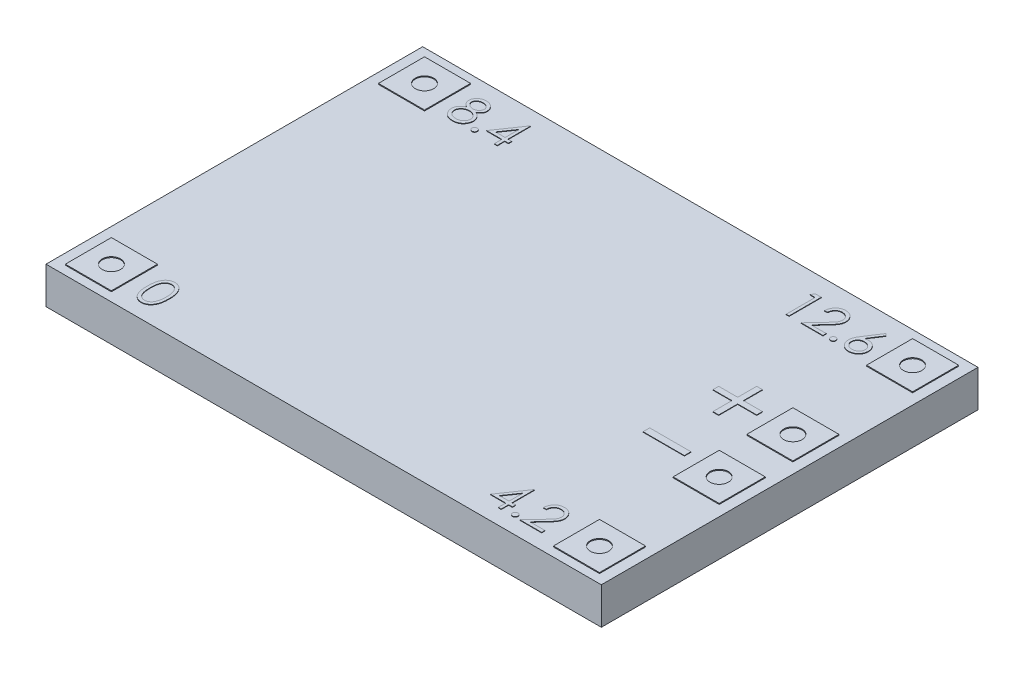
from build123d import *

# Parameters (mm, degrees)
SKETCH_1_W         = 60.3
SKETCH_1_H         = 40.9
EXTRUDE_1_DEPTH    = 4
SKETCH_2_W         = 5
SKETCH_2_H         = 5
SKETCH_2_R         = 1
EXTRUDE_2_DEPTH    = 0.1
EXTRUDE_2_2_DEPTH  = 0.1
EXTRUDE_2_3_DEPTH  = 0.1
EXTRUDE_2_4_DEPTH  = 0.1
EXTRUDE_2_5_DEPTH  = 0.1
EXTRUDE_2_6_DEPTH  = 0.1
EXTRUDE_3_DEPTH    = 0.05
SKETCH_3_W         = 4.487179487
SKETCH_3_H         = 0.717948718
EXTRUDE_3_2_DEPTH  = 0.05
EXTRUDE_3_3_DEPTH  = 0.05
EXTRUDE_3_4_DEPTH  = 0.05
EXTRUDE_3_5_DEPTH  = 0.05
EXTRUDE_3_6_DEPTH  = 0.05
EXTRUDE_3_7_DEPTH  = 0.05
EXTRUDE_3_8_DEPTH  = 0.05
EXTRUDE_3_9_DEPTH  = 0.05
EXTRUDE_3_10_DEPTH = 0.05
EXTRUDE_3_11_DEPTH = 0.05
EXTRUDE_3_12_DEPTH = 0.05
EXTRUDE_3_13_DEPTH = 0.05


with BuildPart() as part:
    # Эскиз1 → Бобышка-Вытянуть1 (new body)
    with BuildSketch(Plane(origin=(0, 0, 0), x_dir=(1, 0, 0), z_dir=(0, 1, 0))):
        Rectangle(SKETCH_1_W, SKETCH_1_H)
    extrude(amount=EXTRUDE_1_DEPTH)


with BuildPart() as body_2:
    # Эскиз2 → Бобышка-Вытянуть2 (new body)
    with BuildSketch(Plane(origin=(0, 4, 0), x_dir=(1, 0, 0), z_dir=(0, 1, 0))):
        with Locations((-26.5, -17)):
            Rectangle(SKETCH_2_W, SKETCH_2_H)
        with Locations((-26.5, -17)):
            Circle(SKETCH_2_R, mode=Mode.SUBTRACT)
    extrude(amount=EXTRUDE_2_DEPTH)


with BuildPart() as body_3:
    # Эскиз2 → Extrude 2 2 (new body)
    with BuildSketch(Plane(origin=(0, 4, 0), x_dir=(1, 0, 0), z_dir=(0, 1, 0))):
        with Locations((-26.5, 17)):
            Rectangle(SKETCH_2_W, SKETCH_2_H)
        with Locations((-26.5, 17)):
            Circle(SKETCH_2_R, mode=Mode.SUBTRACT)
    extrude(amount=EXTRUDE_2_2_DEPTH)


with BuildPart() as body_4:
    # Эскиз2 → Extrude 2 3 (new body)
    with BuildSketch(Plane(origin=(0, 4, 0), x_dir=(1, 0, 0), z_dir=(0, 1, 0))):
        with Locations((26.5, 17)):
            Rectangle(SKETCH_2_W, SKETCH_2_H)
        with Locations((26.5, 17)):
            Circle(SKETCH_2_R, mode=Mode.SUBTRACT)
    extrude(amount=EXTRUDE_2_3_DEPTH)


with BuildPart() as body_5:
    # Эскиз2 → Extrude 2 4 (new body)
    with BuildSketch(Plane(origin=(0, 4, 0), x_dir=(1, 0, 0), z_dir=(0, 1, 0))):
        with Locations((26.5, -17)):
            Rectangle(SKETCH_2_W, SKETCH_2_H)
        with Locations((26.5, -17)):
            Circle(SKETCH_2_R, mode=Mode.SUBTRACT)
    extrude(amount=EXTRUDE_2_4_DEPTH)


with BuildPart() as body_6:
    # Эскиз2 → Extrude 2 5 (new body)
    with BuildSketch(Plane(origin=(0, 4, 0), x_dir=(1, 0, 0), z_dir=(0, 1, 0))):
        with Locations((26.5, 4)):
            Rectangle(SKETCH_2_W, SKETCH_2_H)
        with Locations((26.5, 4)):
            Circle(SKETCH_2_R, mode=Mode.SUBTRACT)
    extrude(amount=EXTRUDE_2_5_DEPTH)


with BuildPart() as body_7:
    # Эскиз2 → Extrude 2 6 (new body)
    with BuildSketch(Plane(origin=(0, 4, 0), x_dir=(1, 0, 0), z_dir=(0, 1, 0))):
        with Locations((26.5, -4)):
            Rectangle(SKETCH_2_W, SKETCH_2_H)
        with Locations((26.5, -4)):
            Circle(SKETCH_2_R, mode=Mode.SUBTRACT)
    extrude(amount=EXTRUDE_2_6_DEPTH)


with BuildPart() as body_8:
    # Эскиз3 → Бобышка-Вытянуть3 (new body)
    with BuildSketch(Plane(origin=(0, 4, 0), x_dir=(1, 0, 0), z_dir=(0, 1, 0))):
        Polygon((19.969849087, 4.535068016), (19.969849087, 6.59917058), (20.598054215, 6.59917058), (20.598054215, 4.535068016), (22.662156779, 4.535068016), (22.662156779, 3.906862888), (20.598054215, 3.906862888), (20.598054215, 1.842760324), (19.969849087, 1.842760324), (19.969849087, 3.906862888), (17.905746523, 3.906862888), (17.905746523, 4.535068016), align=None)
    extrude(amount=EXTRUDE_3_DEPTH)


with BuildPart() as body_9:
    # Эскиз3 → Extrude 3 2 (new body)
    with BuildSketch(Plane(origin=(0, 4, 0), x_dir=(1, 0, 0), z_dir=(0, 1, 0))):
        with Locations((20.312976952, -3.479588137)):
            Rectangle(SKETCH_3_W, SKETCH_3_H)
    extrude(amount=EXTRUDE_3_2_DEPTH)


with BuildPart() as body_10:
    # Эскиз3 → Extrude 3 3 (new body)
    with BuildSketch(Plane(origin=(0, 4, 0), x_dir=(1, 0, 0), z_dir=(0, 1, 0))):
        Polygon((14.459435764, 18.478011487), (15.106571181, 18.478011487), (15.106571181, 14.978011487), (14.792468617, 14.978011487), (14.792468617, 18.119037128), (14.254007078, 18.119037128), align=None)
    extrude(amount=EXTRUDE_3_3_DEPTH)


with BuildPart() as body_11:
    # Эскиз3 → Extrude 3 4 (new body)
    with BuildSketch(Plane(origin=(0, 4, 0), x_dir=(1, 0, 0), z_dir=(0, 1, 0))):
        with BuildLine():
            Line((16.856571181, 17.40108841), (16.542468617, 17.40108841))
            add(Edge.make_bspline(
                [(16.542468617, 17.40108841), (16.54451577, 17.442759298), (16.548536324, 17.524599812), (16.567364613, 17.643923719), (16.59430549, 17.757978517), (16.632396944, 17.865848431), (16.679703222, 17.968487239), (16.736433249, 18.065487254), (16.8036271, 18.156478443), (16.879833834, 18.240617286), (16.962602473, 18.317804857), (17.051908412, 18.3844601), (17.14575344, 18.440777771), (17.243852839, 18.487859013), (17.347313402, 18.523198859), (17.45519626, 18.549420499), (17.567975396, 18.565196844), (17.644815418, 18.56689263), (17.683894899, 18.567755077)],
                knots=[0, 0, 0, 0, 1.10065271, 2.161652631, 3.183658789, 4.190468796, 5.17591951, 6.163126047, 7.15150782, 8.156236427, 9.156009102, 10.134482811, 11.092018607, 12.041330605, 13.001268258, 13.972401359, 14.968799086, 16, 16, 16, 16], degree=3))
            add(Edge.make_bspline(
                [(17.683894899, 18.567755077), (17.722272973, 18.56685662), (17.797684517, 18.565091185), (17.907746532, 18.549930156), (18.012523826, 18.526184564), (18.111811593, 18.492869148), (18.204817657, 18.448084721), (18.292240702, 18.394287182), (18.375121513, 18.332067351), (18.449728296, 18.258813537), (18.518236376, 18.180611153), (18.577338631, 18.097123249), (18.627951794, 18.010893963), (18.670139474, 17.921265762), (18.701195613, 17.827394733), (18.724773821, 17.730647531), (18.738101235, 17.63002272), (18.740146658, 17.561916164), (18.741186565, 17.527290333)],
                knots=[0, 0, 0, 0, 1.111607364, 2.184268762, 3.212621178, 4.221274766, 5.211760367, 6.196651075, 7.1921475, 8.207485113, 9.220403448, 10.201281604, 11.166441695, 12.114753415, 13.065576456, 14.026450734, 14.996634279, 16, 16, 16, 16], degree=3))
            add(Edge.make_bspline(
                [(18.741186565, 17.527290333), (18.739493302, 17.478542498), (18.736136491, 17.381902285), (18.707422115, 17.239887422), (18.662575603, 17.102294003), (18.608578247, 16.991556701), (18.554105803, 16.902323207), (18.505018295, 16.828854502), (18.447553484, 16.749749034), (18.380874986, 16.665271696), (18.306362114, 16.574760791), (18.22333995, 16.478270996), (18.131216468, 16.376799226), (18.066557968, 16.307493625), (18.033053552, 16.271581198)],
                knots=[0, 0, 0, 0, 1.184426356, 2.348067706, 3.509069118, 4.696110526, 5.333549288, 6.050745305, 6.844228056, 7.710549037, 8.667450064, 9.695053472, 10.805634456, 12, 12, 12, 12], degree=3))
            Line((18.033053552, 16.271581198), (17.157352431, 15.336985846))
            Line((17.157352431, 15.336985846), (18.78605836, 15.336985846))
            Line((18.78605836, 15.336985846), (18.78605836, 14.978011487))
            Line((18.78605836, 14.978011487), (16.407853232, 14.978011487))
            Line((16.407853232, 14.978011487), (17.765225027, 16.426529115))
            add(Edge.make_bspline(
                [(17.765225027, 16.426529115), (17.798272914, 16.461027422), (17.861751141, 16.527291608), (17.951533718, 16.624034568), (18.032172706, 16.713784109), (18.104190099, 16.796370657), (18.166023604, 16.873002225), (18.220895836, 16.941196929), (18.264861427, 17.003951379), (18.312576823, 17.076691993), (18.358790804, 17.16550431), (18.39850316, 17.274037999), (18.422718009, 17.385765252), (18.425622844, 17.461267289), (18.427084001, 17.499245461)],
                knots=[0, 0, 0, 0, 1.329631726, 2.553950428, 3.673215718, 4.687767853, 5.603093632, 6.413772471, 7.123043292, 7.734684054, 8.834405432, 9.900288307, 10.943827018, 12, 12, 12, 12], degree=3))
            add(Edge.make_bspline(
                [(18.427084001, 17.499245461), (18.426448259, 17.52312686), (18.425195333, 17.57019251), (18.414137635, 17.639198269), (18.397427129, 17.705763083), (18.373481871, 17.770091702), (18.341875131, 17.831537354), (18.303401751, 17.890174834), (18.259011688, 17.946863799), (18.207660419, 18.000017097), (18.151248899, 18.048698303), (18.091654649, 18.091822388), (18.028604545, 18.127861499), (17.962364423, 18.157404996), (17.893118953, 18.180580377), (17.820734208, 18.196638957), (17.745410192, 18.206721441), (17.693976696, 18.208085613), (17.667769097, 18.208780718)],
                knots=[0, 0, 0, 0, 0.991446411, 1.95395049, 2.89581595, 3.838931463, 4.798493298, 5.75982156, 6.748411868, 7.785213223, 8.824556874, 9.840280684, 10.836137867, 11.835679398, 12.848801643, 13.863922112, 14.911575587, 16, 16, 16, 16], degree=3))
            add(Edge.make_bspline(
                [(17.667769097, 18.208780718), (17.640398265, 18.208065685), (17.586646468, 18.20666148), (17.507727435, 18.196838816), (17.432441658, 18.179892976), (17.360599755, 18.156716301), (17.292080169, 18.127257752), (17.227216125, 18.090566008), (17.166153236, 18.046782515), (17.108776712, 17.997141958), (17.055912733, 17.941874357), (17.009465858, 17.880264394), (16.968881843, 17.813436979), (16.93347261, 17.741572428), (16.90471692, 17.664018648), (16.882743769, 17.581050943), (16.865356923, 17.493029562), (16.859548402, 17.432244477), (16.856571181, 17.40108841)],
                knots=[0, 0, 0, 0, 1.031018746, 2.02475058, 2.990194455, 3.934040569, 4.864654155, 5.795059489, 6.735614925, 7.690564532, 8.649604399, 9.611025574, 10.590972636, 11.591080095, 12.624614302, 13.701020113, 14.821632451, 16, 16, 16, 16], degree=3))
        make_face()
    extrude(amount=EXTRUDE_3_4_DEPTH)


with BuildPart() as body_12:
    # Эскиз3 → Extrude 3 5 (new body)
    with BuildSketch(Plane(origin=(0, 4, 0), x_dir=(1, 0, 0), z_dir=(0, 1, 0))):
        with BuildLine():
            add(Edge.make_bspline(
                [(19.66105836, 15.516473025), (19.680548572, 15.515314859), (19.718756855, 15.513044408), (19.773995983, 15.497467734), (19.823990643, 15.469809074), (19.868522888, 15.432946296), (19.905229364, 15.388250632), (19.933873716, 15.338654724), (19.949314701, 15.282953131), (19.951568613, 15.244523456), (19.952725027, 15.224806359)],
                knots=[0, 0, 0, 0, 1.020151414, 1.999887582, 2.974338812, 3.990962822, 5.007586832, 5.987933904, 6.967670073, 8, 8, 8, 8], degree=3))
            add(Edge.make_bspline(
                [(19.952725027, 15.224806359), (19.951529426, 15.205563029), (19.949171719, 15.167615465), (19.933909111, 15.112334002), (19.905011061, 15.062707098), (19.868776068, 15.01740496), (19.823979634, 14.980464089), (19.773877788, 14.953040745), (19.71888653, 14.936348765), (19.680570206, 14.934222468), (19.66105836, 14.933139692)],
                knots=[0, 0, 0, 0, 1.009421747, 1.99056486, 2.972319754, 3.999869655, 5.017953583, 5.993804169, 6.978383603, 8, 8, 8, 8], degree=3))
            add(Edge.make_bspline(
                [(19.66105836, 14.933139692), (19.641532455, 14.934183289), (19.603412772, 14.936220664), (19.548626778, 14.95338347), (19.498219809, 14.980206931), (19.453432097, 15.01747384), (19.416893626, 15.062473984), (19.389268243, 15.11267578), (19.372678094, 15.167457217), (19.370496221, 15.20553186), (19.369391693, 15.224806359)],
                knots=[0, 0, 0, 0, 1.022052826, 1.995314843, 2.982371812, 4.00089066, 5.028879526, 6.005146991, 6.990147033, 8, 8, 8, 8], degree=3))
            add(Edge.make_bspline(
                [(19.369391693, 15.224806359), (19.370453793, 15.244555738), (19.372527411, 15.283113978), (19.389303071, 15.338313086), (19.416679283, 15.388481525), (19.453684678, 15.432878105), (19.498208974, 15.470065408), (19.548505179, 15.497130201), (19.60354472, 15.513170613), (19.641554658, 15.51535313), (19.66105836, 15.516473025)],
                knots=[0, 0, 0, 0, 1.032775665, 2.016367738, 2.991239715, 4.008302682, 5.025365648, 6.011011707, 6.979408107, 8, 8, 8, 8], degree=3))
        make_face()
    extrude(amount=EXTRUDE_3_5_DEPTH)


with BuildPart() as body_13:
    # Эскиз3 → Extrude 3 6 (new body)
    with BuildSketch(Plane(origin=(0, 4, 0), x_dir=(1, 0, 0), z_dir=(0, 1, 0))):
        with BuildLine():
            Line((22.016827591, 18.567755077), (22.25871461, 18.37775107))
            Line((22.25871461, 18.37775107), (21.333934963, 16.96358841))
            add(Edge.make_bspline(
                [(21.333934963, 16.96358841), (21.39550524, 16.97340227), (21.515605026, 16.992545315), (21.637170925, 16.995703261), (21.696414931, 16.997242256)],
                knots=[0, 0, 0, 0, 1.025318673, 2, 2, 2, 2], degree=3))
            add(Edge.make_bspline(
                [(21.696414931, 16.997242256), (21.731987427, 16.996286144), (21.802010827, 16.994404067), (21.90481763, 16.979920216), (22.003606566, 16.957095104), (22.097968178, 16.923822848), (22.18824116, 16.881320494), (22.274943556, 16.830381624), (22.356445566, 16.768375943), (22.433796745, 16.699110988), (22.504023843, 16.622394003), (22.566199898, 16.540992666), (22.61842669, 16.454991785), (22.660800611, 16.364434919), (22.69370549, 16.26946166), (22.717693135, 16.17019352), (22.731872728, 16.066562049), (22.733798219, 15.996083874), (22.734776309, 15.960283121)],
                knots=[0, 0, 0, 0, 1.04369286, 2.054478336, 3.041073146, 4.015093852, 4.984733326, 5.965804835, 6.960378782, 7.985147595, 9.009457201, 10.008161701, 10.986880575, 11.956520048, 12.937015923, 13.931873656, 14.949455224, 16, 16, 16, 16], degree=3))
            add(Edge.make_bspline(
                [(22.734776309, 15.960283121), (22.733353204, 15.911303417), (22.73055287, 15.814922951), (22.702649074, 15.674546245), (22.65928943, 15.54081373), (22.597311901, 15.415860558), (22.520329518, 15.299857989), (22.426451926, 15.197072523), (22.319008437, 15.105402486), (22.197521639, 15.028745867), (22.066778675, 14.966142816), (21.929426677, 14.921177574), (21.786799531, 14.893494104), (21.689994923, 14.890023501), (21.641026309, 14.888267897)],
                knots=[0, 0, 0, 0, 1.031375318, 2.029502543, 3.004789286, 3.987476834, 4.960371455, 5.9300674, 6.912260825, 7.929083631, 8.949397511, 9.960523116, 10.96833055, 12, 12, 12, 12], degree=3))
            add(Edge.make_bspline(
                [(21.641026309, 14.888267897), (21.593929608, 14.889796103), (21.50063929, 14.892823211), (21.363406496, 14.919789149), (21.231543479, 14.963496251), (21.105974098, 15.02371053), (20.989653485, 15.099768413), (20.885587848, 15.191330692), (20.794296074, 15.296440157), (20.718321453, 15.415080504), (20.658062721, 15.542570462), (20.612872796, 15.675507618), (20.586476553, 15.8134076), (20.582787996, 15.906888739), (20.580930155, 15.953973025)],
                knots=[0, 0, 0, 0, 1.012016664, 2.004627821, 2.994792927, 3.992885782, 4.990978636, 5.973936114, 6.964471063, 7.975201453, 8.993600317, 9.990122807, 10.98767138, 12, 12, 12, 12], degree=3))
            add(Edge.make_bspline(
                [(20.580930155, 15.953973025), (20.5821116, 15.990017608), (20.584523885, 16.06361376), (20.601367275, 16.175077788), (20.62843207, 16.28912887), (20.658742316, 16.385883064), (20.690767927, 16.465144586), (20.717420466, 16.529048076), (20.750594462, 16.59480915), (20.785967843, 16.664682785), (20.826724712, 16.736868218), (20.871040362, 16.812571888), (20.920140013, 16.890589815), (20.954560175, 16.943534011), (20.972156117, 16.970599628)],
                knots=[0, 0, 0, 0, 1.173818275, 2.396712641, 3.66331629, 4.989737886, 5.693666774, 6.447286557, 7.243889047, 8.091586357, 8.998013824, 9.943181721, 10.948533338, 12, 12, 12, 12], degree=3))
            Line((20.972156117, 16.970599628), (22.016827591, 18.567755077))
        make_face()
        with BuildLine():
            add(Edge.make_bspline(
                [(21.630509482, 16.638267897), (21.603847237, 16.637489853), (21.551768128, 16.635970108), (21.475360713, 16.627144856), (21.403047462, 16.610525791), (21.333870328, 16.589359459), (21.269122625, 16.560256399), (21.208333785, 16.5249046), (21.151268733, 16.483283422), (21.098525182, 16.435982511), (21.050705518, 16.384194478), (21.009524387, 16.328724955), (20.974001987, 16.270910752), (20.945120168, 16.21026881), (20.922630093, 16.146822311), (20.906361842, 16.080863061), (20.897308091, 16.011948755), (20.895801859, 15.965216252), (20.895032719, 15.941352833)],
                knots=[0, 0, 0, 0, 1.129588631, 2.206414736, 3.251139165, 4.268635594, 5.265702196, 6.250456724, 7.242448911, 8.251968645, 9.246821453, 10.222880186, 11.173611482, 12.116736599, 13.062300278, 14.020270554, 14.989073742, 16, 16, 16, 16], degree=3))
            add(Edge.make_bspline(
                [(20.895032719, 15.941352833), (20.895659081, 15.917702853), (20.896887282, 15.871328763), (20.908039602, 15.802989584), (20.925074684, 15.737224675), (20.95041508, 15.674373077), (20.980641968, 15.613476758), (21.020547293, 15.556741473), (21.064764078, 15.500721403), (21.117618012, 15.449719932), (21.174341375, 15.402263307), (21.234942577, 15.360783054), (21.298102537, 15.32529688), (21.364673959, 15.297485783), (21.433712343, 15.274661496), (21.505792897, 15.258600017), (21.580965753, 15.249519491), (21.631887691, 15.248011297), (21.657853232, 15.247242256)],
                knots=[0, 0, 0, 0, 0.989467248, 1.94019797, 2.891935182, 3.827694429, 4.772920941, 5.730924762, 6.725747692, 7.756678648, 8.79901574, 9.819492441, 10.826891316, 11.826466727, 12.835195252, 13.867842842, 14.912794438, 16, 16, 16, 16], degree=3))
            add(Edge.make_bspline(
                [(21.657853232, 15.247242256), (21.68381873, 15.248011357), (21.734740585, 15.249519669), (21.809914045, 15.258599338), (21.881992364, 15.274663986), (21.951038873, 15.297476756), (22.017580304, 15.325330366), (22.080685025, 15.360562286), (22.140713119, 15.402518403), (22.197473718, 15.449638832), (22.250107657, 15.501011684), (22.295384935, 15.556241406), (22.334068169, 15.613935301), (22.365502356, 15.674133191), (22.390563647, 15.737262679), (22.407685114, 15.802979403), (22.418814403, 15.871331429), (22.420045769, 15.917703753), (22.420673745, 15.941352833)],
                knots=[0, 0, 0, 0, 1.087397944, 2.132534446, 3.165364764, 4.174271784, 5.174024072, 6.181601208, 7.194203697, 8.236725232, 9.267838612, 10.269026844, 11.221737037, 12.171628256, 13.107553087, 14.05945871, 15.010357665, 16, 16, 16, 16], degree=3))
            add(Edge.make_bspline(
                [(22.420673745, 15.941352833), (22.420123452, 15.965247384), (22.419043406, 16.012144616), (22.406827457, 16.080832235), (22.389885083, 16.147157441), (22.364302052, 16.21070339), (22.331065508, 16.271219317), (22.290582101, 16.329010918), (22.24374953, 16.384521265), (22.189651991, 16.436084074), (22.130761757, 16.483231152), (22.068146171, 16.524850708), (22.002638198, 16.559975685), (21.934304255, 16.589282787), (21.862361373, 16.610432261), (21.787971033, 16.627085504), (21.710181791, 16.635947522), (21.657405183, 16.637484587), (21.630509482, 16.638267897)],
                knots=[0, 0, 0, 0, 0.978206639, 1.919901502, 2.851605144, 3.780102724, 4.718870031, 5.675451981, 6.667674623, 7.690630536, 8.733308323, 9.756129687, 10.767539656, 11.776269907, 12.797430371, 13.836405707, 14.897401972, 16, 16, 16, 16], degree=3))
        make_face(mode=Mode.SUBTRACT)
    extrude(amount=EXTRUDE_3_6_DEPTH)


with BuildPart() as body_14:
    # Эскиз3 → Extrude 3 7 (new body)
    with BuildSketch(Plane(origin=(0, 4, 0), x_dir=(1, 0, 0), z_dir=(0, 1, 0))):
        with BuildLine():
            add(Edge.make_bspline(
                [(-21.036907543, 17.122772779), (-21.008258996, 17.107834824), (-20.952384762, 17.078700821), (-20.872807554, 17.031789993), (-20.800082552, 16.982349028), (-20.73219199, 16.932713169), (-20.67032864, 16.880981517), (-20.615184227, 16.826948361), (-20.565396607, 16.771962416), (-20.521969823, 16.715092576), (-20.483772986, 16.656489926), (-20.450760851, 16.596000653), (-20.422543648, 16.53375732), (-20.400180709, 16.46908049), (-20.381758918, 16.402920228), (-20.369083313, 16.334422246), (-20.362266395, 16.264037905), (-20.360977581, 16.216469604), (-20.360325011, 16.192384158)],
                knots=[0, 0, 0, 0, 1.272397273, 2.481599622, 3.635517121, 4.734568067, 5.792894095, 6.808321871, 7.773003508, 8.711915296, 9.623354172, 10.525449501, 11.423591555, 12.311487226, 13.218079475, 14.126165749, 15.051214107, 16, 16, 16, 16], degree=3))
            add(Edge.make_bspline(
                [(-20.360325011, 16.192384158), (-20.361096432, 16.158686425), (-20.362623363, 16.091985968), (-20.375923347, 15.993539857), (-20.395836325, 15.897928075), (-20.424915837, 15.805171584), (-20.462629228, 15.715782211), (-20.509106064, 15.629683437), (-20.561717269, 15.545464128), (-20.603969509, 15.493644726), (-20.62534905, 15.467424222)],
                knots=[0, 0, 0, 0, 1.025265484, 2.029385089, 3.018602448, 3.995076438, 4.983346944, 5.966715145, 6.97116228, 8, 8, 8, 8], degree=3))
            add(Edge.make_bspline(
                [(-20.62534905, 15.467424222), (-20.653185524, 15.436830448), (-20.70851449, 15.376020955), (-20.803297417, 15.297070145), (-20.907319301, 15.230720751), (-21.020177634, 15.176648856), (-21.141570735, 15.134562997), (-21.27147274, 15.104320479), (-21.410136893, 15.08699805), (-21.505442364, 15.084494061), (-21.554335428, 15.083209478)],
                knots=[0, 0, 0, 0, 0.954267603, 1.896743057, 2.838368354, 3.796610408, 4.779680527, 5.799409237, 6.871065594, 8, 8, 8, 8], degree=3))
            add(Edge.make_bspline(
                [(-21.554335428, 15.083209478), (-21.601348817, 15.084361956), (-21.692832096, 15.086604561), (-21.825989973, 15.101798993), (-21.950113043, 15.128426859), (-22.065923011, 15.164871469), (-22.172721705, 15.212281697), (-22.270204806, 15.271290106), (-22.359778778, 15.339521548), (-22.438725252, 15.418935626), (-22.508813696, 15.503993499), (-22.570381749, 15.591745108), (-22.621555827, 15.682198466), (-22.664882923, 15.774004833), (-22.698050945, 15.868450987), (-22.721023156, 15.965051), (-22.73561247, 16.063636143), (-22.737553604, 16.130167796), (-22.73853014, 16.163638164)],
                knots=[0, 0, 0, 0, 1.256902934, 2.445805442, 3.576955095, 4.645999104, 5.686449165, 6.692658513, 7.68621702, 8.689161843, 9.678783111, 10.630372946, 11.551080876, 12.453998257, 13.34127905, 14.221779781, 15.105423033, 16, 16, 16, 16], degree=3))
            add(Edge.make_bspline(
                [(-22.73853014, 16.163638164), (-22.737952259, 16.188197356), (-22.736810162, 16.236734988), (-22.728905313, 16.308444316), (-22.716196852, 16.378240451), (-22.698937395, 16.446381195), (-22.675546369, 16.512370467), (-22.647304236, 16.576520941), (-22.614372283, 16.63890504), (-22.576291118, 16.699863921), (-22.531989094, 16.758543433), (-22.481825444, 16.815939428), (-22.424797576, 16.871161295), (-22.361539917, 16.92488372), (-22.292775377, 16.978059694), (-22.216717847, 17.027815422), (-22.135383579, 17.077673387), (-22.077578174, 17.107481712), (-22.047925172, 17.122772779)],
                knots=[0, 0, 0, 0, 0.941657376, 1.861047343, 2.762797495, 3.66048619, 4.553285746, 5.444104102, 6.34607688, 7.256116206, 8.197091036, 9.162375105, 10.176350973, 11.237807142, 12.343728897, 13.50695164, 14.721116704, 16, 16, 16, 16], degree=3))
            add(Edge.make_bspline(
                [(-22.047925172, 17.122772779), (-22.088516546, 17.144907548), (-22.167112809, 17.187766656), (-22.27118225, 17.266513462), (-22.360572874, 17.351801277), (-22.432827591, 17.445431071), (-22.48969982, 17.544477946), (-22.528718424, 17.648322198), (-22.555114908, 17.755038312), (-22.557729735, 17.827944508), (-22.55904296, 17.864559638)],
                knots=[0, 0, 0, 0, 1.166880483, 2.259407225, 3.286803203, 4.280235371, 5.237608625, 6.161067461, 7.076446754, 8, 8, 8, 8], degree=3))
            add(Edge.make_bspline(
                [(-22.55904296, 17.864559638), (-22.557407536, 17.901857197), (-22.554120048, 17.976831794), (-22.527536728, 18.088437917), (-22.484216661, 18.198054482), (-22.425295664, 18.305150195), (-22.351908448, 18.40610041), (-22.263861902, 18.496641356), (-22.163258605, 18.575952838), (-22.050600738, 18.642529011), (-21.929364503, 18.69671267), (-21.801448779, 18.734091093), (-21.669082286, 18.758527209), (-21.578984566, 18.761293864), (-21.533301774, 18.762696658)],
                knots=[0, 0, 0, 0, 0.888701115, 1.786444228, 2.72001202, 3.692817113, 4.693886446, 5.687152267, 6.695133018, 7.739871481, 8.800368666, 9.853104506, 10.91144658, 12, 12, 12, 12], degree=3))
            add(Edge.make_bspline(
                [(-21.533301774, 18.762696658), (-21.488797959, 18.761250315), (-21.401041506, 18.758398291), (-21.272046879, 18.734611413), (-21.148622001, 18.694881893), (-21.031192502, 18.64098467), (-20.921860635, 18.574597729), (-20.825258325, 18.494196855), (-20.739925743, 18.404055304), (-20.669341349, 18.303135701), (-20.61117846, 18.196451507), (-20.570677559, 18.084828986), (-20.544725585, 17.970679927), (-20.541452221, 17.893441923), (-20.539812191, 17.854743933)],
                knots=[0, 0, 0, 0, 1.072916533, 2.115669174, 3.151510826, 4.193348718, 5.225979165, 6.227137561, 7.216255879, 8.211077061, 9.189680878, 10.138522389, 11.067357538, 12, 12, 12, 12], degree=3))
            add(Edge.make_bspline(
                [(-20.539812191, 17.854743933), (-20.541246752, 17.816767269), (-20.544064147, 17.74218326), (-20.567764087, 17.63345674), (-20.6076774, 17.531634701), (-20.662171563, 17.435561749), (-20.733197051, 17.346980251), (-20.819805784, 17.264763781), (-20.921307262, 17.188236953), (-20.997568148, 17.145050588), (-21.036907543, 17.122772779)],
                knots=[0, 0, 0, 0, 0.975232327, 1.915300861, 2.843280834, 3.77672583, 4.742871857, 5.749627742, 6.839139064, 8, 8, 8, 8], degree=3))
        make_face()
        with BuildLine():
            add(Edge.make_bspline(
                [(-21.550829819, 18.403722299), (-21.575380625, 18.403070858), (-21.623412736, 18.401796356), (-21.693841407, 18.395137719), (-21.760813775, 18.382184502), (-21.825029575, 18.36494579), (-21.885608387, 18.341657802), (-21.943372942, 18.314262793), (-21.997340132, 18.280956727), (-22.048161435, 18.243595529), (-22.093912209, 18.202502623), (-22.134516761, 18.159688905), (-22.168244875, 18.114313513), (-22.196885985, 18.067505153), (-22.217667502, 18.017874577), (-22.233231806, 17.9669434), (-22.243753197, 17.914068016), (-22.244541588, 17.877931506), (-22.244940396, 17.859651786)],
                knots=[0, 0, 0, 0, 1.203892937, 2.355340988, 3.463153438, 4.544400666, 5.610487187, 6.640501085, 7.674077295, 8.714426146, 9.728707835, 10.68524104, 11.601827946, 12.495867327, 13.368432065, 14.231010473, 15.105153427, 16, 16, 16, 16], degree=3))
            add(Edge.make_bspline(
                [(-22.244940396, 17.859651786), (-22.244253029, 17.841371276), (-22.242894693, 17.805246363), (-22.232389565, 17.751900497), (-22.216732711, 17.699478861), (-22.192082049, 17.64922795), (-22.162515691, 17.59940459), (-22.126024215, 17.551254004), (-22.082535187, 17.50460862), (-22.033507747, 17.459865178), (-21.980096209, 17.417966415), (-21.923512166, 17.381593234), (-21.864465774, 17.351159123), (-21.803563705, 17.325829719), (-21.740185258, 17.306139781), (-21.674718784, 17.292171135), (-21.607153282, 17.283489138), (-21.561372701, 17.282452117), (-21.538209627, 17.281927427)],
                knots=[0, 0, 0, 0, 0.873023192, 1.725219244, 2.590779336, 3.480155217, 4.391973325, 5.357036234, 6.360879153, 7.436073238, 8.526419356, 9.601555421, 10.645666583, 11.697338044, 12.750135903, 13.812665442, 14.89329948, 16, 16, 16, 16], degree=3))
            add(Edge.make_bspline(
                [(-21.538209627, 17.281927427), (-21.508459523, 17.282800294), (-21.449253155, 17.284537407), (-21.361973824, 17.300688581), (-21.277111179, 17.326094499), (-21.195572275, 17.360854465), (-21.11946769, 17.404482325), (-21.051627621, 17.456715343), (-20.992630729, 17.51634744), (-20.943090118, 17.582450276), (-20.904680272, 17.652801864), (-20.874778464, 17.723402157), (-20.857317249, 17.795004388), (-20.855039682, 17.842971352), (-20.853914755, 17.866663004)],
                knots=[0, 0, 0, 0, 1.076279235, 2.141928126, 3.20205304, 4.278698113, 5.344010996, 6.36967002, 7.368914609, 8.37248503, 9.349703398, 10.264243087, 11.142681841, 12, 12, 12, 12], degree=3))
            add(Edge.make_bspline(
                [(-20.853914755, 17.866663004), (-20.854446653, 17.88329104), (-20.855502393, 17.916295308), (-20.864202449, 17.965033673), (-20.878578282, 18.012663257), (-20.898041362, 18.059577527), (-20.923651157, 18.105118259), (-20.954015344, 18.150001347), (-20.990899846, 18.193217111), (-21.032296279, 18.23577266), (-21.079241688, 18.275156683), (-21.1316456, 18.309791394), (-21.18923935, 18.33920375), (-21.2520243, 18.363092505), (-21.319769225, 18.381034855), (-21.392162099, 18.394471202), (-21.469806546, 18.402044314), (-21.523236297, 18.403150839), (-21.550829819, 18.403722299)],
                knots=[0, 0, 0, 0, 0.814439003, 1.616544685, 2.417341072, 3.248991801, 4.09997495, 4.973547432, 5.9003056, 6.880240646, 7.880314356, 8.896779544, 9.951930927, 11.043077905, 12.18215768, 13.381699519, 14.647792085, 16, 16, 16, 16], degree=3))
        make_face(mode=Mode.SUBTRACT)
        with BuildLine():
            add(Edge.make_bspline(
                [(-21.530497287, 16.922953068), (-21.561623073, 16.922399427), (-21.622684269, 16.921313317), (-21.712141197, 16.909223817), (-21.797994363, 16.892394424), (-21.879954299, 16.866863585), (-21.957986396, 16.833667095), (-22.032513079, 16.793732555), (-22.102964208, 16.746527112), (-22.168366934, 16.692650496), (-22.228090264, 16.634591042), (-22.280488564, 16.573128907), (-22.324986084, 16.509406375), (-22.360819335, 16.442614145), (-22.390231067, 16.374166534), (-22.409544945, 16.302358939), (-22.421926656, 16.228571826), (-22.423589288, 16.178411727), (-22.424427576, 16.153121337)],
                knots=[0, 0, 0, 0, 1.140299081, 2.23698856, 3.303958914, 4.344563908, 5.37730929, 6.408454204, 7.439741482, 8.480804886, 9.510774543, 10.48932336, 11.43758569, 12.353841022, 13.263987381, 14.161954604, 15.073269652, 16, 16, 16, 16], degree=3))
            add(Edge.make_bspline(
                [(-22.424427576, 16.153121337), (-22.423064317, 16.121690431), (-22.420359643, 16.059332248), (-22.398903004, 15.967169176), (-22.364467469, 15.877948122), (-22.316442253, 15.792396169), (-22.25697468, 15.712446063), (-22.183848212, 15.642757287), (-22.101607375, 15.580835808), (-22.007469521, 15.530755275), (-21.904641055, 15.49076042), (-21.793149326, 15.463204457), (-21.674594407, 15.444963007), (-21.592734815, 15.443124826), (-21.550829819, 15.442183837)],
                knots=[0, 0, 0, 0, 0.898778495, 1.783155532, 2.693654817, 3.627872908, 4.583023416, 5.533784346, 6.509005473, 7.520592997, 8.575161974, 9.658835044, 10.801527049, 12, 12, 12, 12], degree=3))
            add(Edge.make_bspline(
                [(-21.550829819, 15.442183837), (-21.518079451, 15.442812646), (-21.454271232, 15.444037766), (-21.361185283, 15.45485206), (-21.273340735, 15.472001685), (-21.190907936, 15.496945231), (-21.112964097, 15.527395207), (-21.040830742, 15.566567289), (-20.972652215, 15.611119612), (-20.911788093, 15.663977768), (-20.856354884, 15.720457263), (-20.808021591, 15.780247306), (-20.76606404, 15.841722939), (-20.733133084, 15.906273423), (-20.706806831, 15.972660338), (-20.687883276, 16.041495849), (-20.676207061, 16.112991082), (-20.675026165, 16.161490153), (-20.674427576, 16.186074062)],
                knots=[0, 0, 0, 0, 1.224942928, 2.386581632, 3.501229538, 4.569074225, 5.605009692, 6.626002462, 7.634866581, 8.645888296, 9.63523824, 10.59253846, 11.518950513, 12.414518923, 13.29783783, 14.186679152, 15.080837789, 16, 16, 16, 16], degree=3))
            add(Edge.make_bspline(
                [(-20.674427576, 16.186074062), (-20.675333424, 16.209951402), (-20.677119599, 16.257033347), (-20.688456291, 16.326799873), (-20.708372168, 16.394202688), (-20.735699565, 16.460052694), (-20.772080527, 16.523015644), (-20.814925397, 16.584731816), (-20.866619516, 16.64348826), (-20.925032112, 16.699741356), (-20.988691073, 16.751757093), (-21.056358218, 16.797771532), (-21.12751268, 16.836523648), (-21.20200389, 16.868040143), (-21.279666446, 16.892827613), (-21.360443225, 16.910143608), (-21.4444288, 16.921043211), (-21.501483671, 16.922309257), (-21.530497287, 16.922953068)],
                knots=[0, 0, 0, 0, 0.917430815, 1.809013306, 2.70690318, 3.612392954, 4.541220862, 5.495268465, 6.494511384, 7.542276156, 8.608045339, 9.649016899, 10.681629292, 11.715607085, 12.752076957, 13.808767841, 14.885711793, 16, 16, 16, 16], degree=3))
        make_face(mode=Mode.SUBTRACT)
    extrude(amount=EXTRUDE_3_7_DEPTH)


with BuildPart() as body_15:
    # Эскиз3 → Extrude 3 8 (new body)
    with BuildSketch(Plane(origin=(0, 4, 0), x_dir=(1, 0, 0), z_dir=(0, 1, 0))):
        with BuildLine():
            add(Edge.make_bspline(
                [(-19.485325011, 15.711414606), (-19.465834799, 15.71025644), (-19.427626517, 15.707985989), (-19.372387389, 15.692409316), (-19.322392729, 15.664750655), (-19.277860484, 15.627887877), (-19.241154008, 15.583192214), (-19.212509655, 15.533596305), (-19.19706867, 15.477894712), (-19.194814758, 15.439465037), (-19.193658345, 15.41974794)],
                knots=[0, 0, 0, 0, 1.020151414, 1.999887582, 2.974338812, 3.990962822, 5.007586832, 5.987933904, 6.967670073, 8, 8, 8, 8], degree=3))
            add(Edge.make_bspline(
                [(-19.193658345, 15.41974794), (-19.194853946, 15.40050461), (-19.197211653, 15.362557046), (-19.212474261, 15.307275584), (-19.241372311, 15.257648679), (-19.277607304, 15.212346541), (-19.322403737, 15.17540567), (-19.372505584, 15.147982326), (-19.427496842, 15.131290346), (-19.465813165, 15.129164049), (-19.485325011, 15.128081273)],
                knots=[0, 0, 0, 0, 1.009421747, 1.99056486, 2.972319754, 3.999869655, 5.017953583, 5.993804169, 6.978383603, 8, 8, 8, 8], degree=3))
            add(Edge.make_bspline(
                [(-19.485325011, 15.128081273), (-19.504850917, 15.12912487), (-19.5429706, 15.131162245), (-19.597756594, 15.148325052), (-19.648163563, 15.175148512), (-19.692951274, 15.212415421), (-19.729489746, 15.257415565), (-19.757115129, 15.307617361), (-19.773705278, 15.362398799), (-19.77588715, 15.400473441), (-19.776991678, 15.41974794)],
                knots=[0, 0, 0, 0, 1.022052826, 1.995314843, 2.982371812, 4.00089066, 5.028879526, 6.005146991, 6.990147033, 8, 8, 8, 8], degree=3))
            add(Edge.make_bspline(
                [(-19.776991678, 15.41974794), (-19.775929579, 15.439497319), (-19.77385596, 15.478055559), (-19.7570803, 15.533254667), (-19.729704088, 15.583423106), (-19.692698693, 15.627819686), (-19.648174397, 15.665006989), (-19.597878192, 15.692071782), (-19.542838652, 15.708112194), (-19.504828713, 15.710294711), (-19.485325011, 15.711414606)],
                knots=[0, 0, 0, 0, 1.032775665, 2.016367738, 2.991239715, 4.008302682, 5.025365648, 6.011011707, 6.979408107, 8, 8, 8, 8], degree=3))
        make_face()
    extrude(amount=EXTRUDE_3_8_DEPTH)


with BuildPart() as body_16:
    # Эскиз3 → Extrude 3 9 (new body)
    with BuildSketch(Plane(origin=(0, 4, 0), x_dir=(1, 0, 0), z_dir=(0, 1, 0))):
        Polygon((-16.834383505, 18.762696658), (-16.770581422, 18.762696658), (-16.770581422, 16.339619735), (-16.366735268, 16.339619735), (-16.366735268, 15.980645376), (-16.770581422, 15.980645376), (-16.770581422, 15.172953068), (-17.084683986, 15.172953068), (-17.084683986, 15.980645376), (-18.744940396, 15.980645376), align=None)
        Polygon((-17.084683986, 16.339619735), (-17.084683986, 17.859651786), (-18.127953217, 16.339619735), align=None, mode=Mode.SUBTRACT)
    extrude(amount=EXTRUDE_3_9_DEPTH)


with BuildPart() as body_17:
    # Эскиз3 → Extrude 3 10 (new body)
    with BuildSketch(Plane(origin=(0, 4, 0), x_dir=(1, 0, 0), z_dir=(0, 1, 0))):
        with BuildLine():
            add(Edge.make_bspline(
                [(-22.543588558, -17.063264827), (-22.54326054, -17.007167439), (-22.54262336, -16.898197455), (-22.535534939, -16.739412813), (-22.523759597, -16.590452524), (-22.507622224, -16.451309458), (-22.487984244, -16.321947693), (-22.461768757, -16.202712936), (-22.431955955, -16.093053329), (-22.397403509, -15.992611281), (-22.35841572, -15.900033578), (-22.315981459, -15.813608377), (-22.268416665, -15.733466444), (-22.218439752, -15.658328654), (-22.16402768, -15.589424959), (-22.10672889, -15.525782297), (-22.044307014, -15.468871546), (-21.978884005, -15.417025244), (-21.909867541, -15.371575772), (-21.839224875, -15.331543033), (-21.766469769, -15.297343166), (-21.691403586, -15.27045273), (-21.614701028, -15.248241884), (-21.536093961, -15.233052936), (-21.455452597, -15.223496027), (-21.401021163, -15.22258236), (-21.373416283, -15.222118993)],
                knots=[0, 0, 0, 0, 1.646270934, 3.197905019, 4.663502075, 6.030701355, 7.308322542, 8.50163776, 9.611534131, 10.641858119, 11.616356847, 12.558055219, 13.465016945, 14.349605745, 15.204443733, 16.039544428, 16.859896111, 17.680448484, 18.487036065, 19.28249412, 20.06191084, 20.843045899, 21.620316918, 22.403196591, 23.190181807, 24, 24, 24, 24], degree=3))
            add(Edge.make_bspline(
                [(-21.373416283, -15.222118993), (-21.345580804, -15.222606809), (-21.290224795, -15.223576919), (-21.20838442, -15.232900862), (-21.128434738, -15.248371985), (-21.0507166, -15.27029296), (-20.974591613, -15.297488636), (-20.900655206, -15.331575753), (-20.828448124, -15.371254621), (-20.759117837, -15.417878498), (-20.691903221, -15.469860774), (-20.628455258, -15.528623443), (-20.568768172, -15.593573162), (-20.512092867, -15.664015026), (-20.46003727, -15.741300111), (-20.410463837, -15.824084221), (-20.366091802, -15.913815086), (-20.323357126, -16.008995554), (-20.28647014, -16.112259212), (-20.253203894, -16.223023973), (-20.226324926, -16.34259816), (-20.203935653, -16.470354405), (-20.186590758, -16.606761888), (-20.173958115, -16.751528204), (-20.16728503, -16.904748594), (-20.166028329, -17.009506444), (-20.16538343, -17.063264827)],
                knots=[0, 0, 0, 0, 0.810914788, 1.612654377, 2.396697861, 3.181598691, 3.963628158, 4.749916497, 5.551656086, 6.361998678, 7.18212741, 8.025565596, 8.878627764, 9.750805457, 10.657531673, 11.591944965, 12.560506719, 13.57287815, 14.630710178, 15.753379473, 16.941251878, 18.199788006, 19.531962791, 20.947069417, 22.433333509, 24, 24, 24, 24], degree=3))
            add(Edge.make_bspline(
                [(-20.16538343, -17.063264827), (-20.166035015, -17.116788735), (-20.167304601, -17.221077887), (-20.173883307, -17.373608862), (-20.186841939, -17.517606905), (-20.203051927, -17.653417368), (-20.22550289, -17.780474986), (-20.253108056, -17.899219435), (-20.283758379, -18.010163507), (-20.321593173, -18.112398318), (-20.363003883, -18.207350041), (-20.40805908, -18.296017189), (-20.456328906, -18.379183482), (-20.508917651, -18.456183229), (-20.564971064, -18.527561886), (-20.625688853, -18.592059509), (-20.689359438, -18.651230181), (-20.756771854, -18.703881808), (-20.827183405, -18.749966613), (-20.899142482, -18.791180463), (-20.973925865, -18.824413158), (-21.049838818, -18.852948199), (-21.127967184, -18.874748651), (-21.208213575, -18.889822507), (-21.290169811, -18.900394355), (-21.345571376, -18.901200835), (-21.373416283, -18.901606173)],
                knots=[0, 0, 0, 0, 1.561518951, 3.042555995, 4.452378317, 5.7783523, 7.031515105, 8.214008947, 9.334062868, 10.386615937, 11.391082383, 12.354592575, 13.286541444, 14.194233754, 15.072674879, 15.931287219, 16.775624067, 17.606195743, 18.42308326, 19.229000347, 20.022332153, 20.807536673, 21.593273796, 22.3848459, 23.188221202, 24, 24, 24, 24], degree=3))
            add(Edge.make_bspline(
                [(-21.373416283, -18.901606173), (-21.401020397, -18.901139817), (-21.455450322, -18.900220256), (-21.536102747, -18.890706524), (-21.61438519, -18.875411021), (-21.690683944, -18.853994417), (-21.76539046, -18.82777958), (-21.837486746, -18.793625897), (-21.90777443, -18.754291828), (-21.976065986, -18.709496406), (-22.041078147, -18.658174723), (-22.103176752, -18.601410435), (-22.160801771, -18.537787023), (-22.214435867, -18.4683091), (-22.265409955, -18.393615858), (-22.312299329, -18.312687485), (-22.355670183, -18.225844874), (-22.395313673, -18.132526964), (-22.430462337, -18.031372036), (-22.461510045, -17.921222857), (-22.486024202, -17.801107221), (-22.507007158, -17.671989854), (-22.523931541, -17.533315924), (-22.535485866, -17.385010145), (-22.542627181, -17.227164937), (-22.543262252, -17.118895162), (-22.543588558, -17.063264827)],
                knots=[0, 0, 0, 0, 0.810891512, 1.598919785, 2.382837074, 3.152667961, 3.926044502, 4.706494248, 5.493654104, 6.291793342, 7.103789334, 7.925228297, 8.761435821, 9.622817696, 10.50288917, 11.416980706, 12.369136599, 13.353924996, 14.394355917, 15.514179734, 16.714354668, 17.994756427, 19.357759367, 20.818452758, 22.365282078, 24, 24, 24, 24], degree=3))
        make_face()
        with BuildLine():
            add(Edge.make_bspline(
                [(-22.229485994, -17.061862583), (-22.229366547, -17.108611282), (-22.229134724, -17.199341327), (-22.223078523, -17.331184588), (-22.214828291, -17.454154917), (-22.204186994, -17.568408453), (-22.188384046, -17.673558466), (-22.170677258, -17.770328149), (-22.149129168, -17.858205386), (-22.12363415, -17.937793196), (-22.094595054, -18.010442265), (-22.06288919, -18.07804348), (-22.028828467, -18.141395416), (-21.990709316, -18.199929025), (-21.949194253, -18.253835189), (-21.905220994, -18.304068021), (-21.85714841, -18.348865003), (-21.790644667, -18.402591858), (-21.702848193, -18.458110991), (-21.592227738, -18.506457081), (-21.478559287, -18.536839538), (-21.401408037, -18.540703294), (-21.362899456, -18.542631814)],
                knots=[0, 0, 0, 0, 1.459021318, 2.831673884, 4.118529203, 5.306027144, 6.411944654, 7.436330062, 8.375795394, 9.233974572, 10.042671642, 10.816086306, 11.563610507, 12.285937304, 12.993564865, 13.685989202, 14.367179055, 15.041617293, 16.353048772, 17.594441528, 18.799311195, 20, 20, 20, 20], degree=3))
            add(Edge.make_bspline(
                [(-21.362899456, -18.542631814), (-21.324141784, -18.541034033), (-21.246706461, -18.53784177), (-21.133572666, -18.507043033), (-21.023742396, -18.460573493), (-20.937670456, -18.405625988), (-20.872187912, -18.353297659), (-20.825270922, -18.30868301), (-20.782208874, -18.258727143), (-20.741366799, -18.204827847), (-20.703907723, -18.145955363), (-20.669844585, -18.082392788), (-20.638761238, -18.01396361), (-20.621052192, -17.966193871), (-20.611998014, -17.941770436)],
                knots=[0, 0, 0, 0, 1.353760809, 2.704726607, 4.075137775, 5.516104923, 6.260822281, 7.007110065, 7.778089737, 8.566572457, 9.372053459, 10.217411131, 11.088608312, 12, 12, 12, 12], degree=3))
            add(Edge.make_bspline(
                [(-20.611998014, -17.941770436), (-20.601446246, -17.910540696), (-20.580021632, -17.847130932), (-20.552409858, -17.74876728), (-20.530664458, -17.645564516), (-20.511101093, -17.538139399), (-20.497748037, -17.425699698), (-20.487000224, -17.308593314), (-20.480669537, -17.186731952), (-20.479884786, -17.103936961), (-20.479485994, -17.061862583)],
                knots=[0, 0, 0, 0, 0.884706709, 1.796334032, 2.740027952, 3.714592787, 4.726048262, 5.777819803, 6.87074269, 8, 8, 8, 8], degree=3))
            add(Edge.make_bspline(
                [(-20.479485994, -17.061862583), (-20.480036184, -17.019795011), (-20.481112471, -16.937501846), (-20.485226459, -16.816983665), (-20.495850034, -16.702515904), (-20.507649152, -16.593605432), (-20.525046374, -16.490855129), (-20.54380418, -16.393404824), (-20.569005393, -16.302461799), (-20.595925168, -16.216602217), (-20.626735563, -16.136801563), (-20.660651297, -16.062687776), (-20.696873056, -15.993903052), (-20.736215297, -15.93063611), (-20.77821098, -15.872603567), (-20.823968529, -15.820968972), (-20.871672902, -15.774132004), (-20.938490088, -15.720669435), (-21.025964377, -15.66615774), (-21.134810025, -15.61599198), (-21.248080669, -15.587183687), (-21.324654123, -15.583122), (-21.362899456, -15.581093352)],
                knots=[0, 0, 0, 0, 1.31362396, 2.569729283, 3.763502607, 4.902122613, 5.988968491, 7.01645872, 7.998833611, 8.933434873, 9.825090667, 10.667526885, 11.477055099, 12.250526234, 12.991942729, 13.710640831, 14.402115721, 15.076753259, 16.378508321, 17.609869233, 18.806226677, 20, 20, 20, 20], degree=3))
            add(Edge.make_bspline(
                [(-21.362899456, -15.581093352), (-21.401610048, -15.583124799), (-21.479101754, -15.587191393), (-21.593549708, -15.615884647), (-21.70325406, -15.665897613), (-21.790497035, -15.720849985), (-21.857360821, -15.773188297), (-21.904443515, -15.818574751), (-21.948589687, -15.868221005), (-21.989257387, -15.92262292), (-22.02734667, -15.981088287), (-22.062327683, -16.044077052), (-22.093845012, -16.111908416), (-22.122929549, -16.184524852), (-22.148502337, -16.264105796), (-22.1695963, -16.35187479), (-22.189083353, -16.448336681), (-22.202878622, -16.554056189), (-22.215142378, -16.668338343), (-22.223023725, -16.791615661), (-22.229154983, -16.923680041), (-22.229373447, -17.0148792), (-22.229485994, -17.061862583)],
                knots=[0, 0, 0, 0, 1.207732386, 2.417664972, 3.655092373, 4.956220595, 5.625982001, 6.301752483, 6.994047911, 7.697131622, 8.419323945, 9.170223765, 9.943494443, 10.752040957, 11.610060368, 12.549350801, 13.567764191, 14.679664412, 15.874934091, 17.154273443, 18.533957287, 20, 20, 20, 20], degree=3))
        make_face(mode=Mode.SUBTRACT)
    extrude(amount=EXTRUDE_3_10_DEPTH)


with BuildPart() as body_18:
    # Эскиз3 → Extrude 3 11 (new body)
    with BuildSketch(Plane(origin=(0, 4, 0), x_dir=(1, 0, 0), z_dir=(0, 1, 0))):
        Polygon((17.575518242, -15.222118993), (17.639320326, -15.222118993), (17.639320326, -17.645195916), (18.04316648, -17.645195916), (18.04316648, -18.004170275), (17.639320326, -18.004170275), (17.639320326, -18.811862583), (17.325217762, -18.811862583), (17.325217762, -18.004170275), (15.664961351, -18.004170275), align=None)
        Polygon((17.325217762, -17.645195916), (17.325217762, -16.125163865), (16.281948531, -17.645195916), align=None, mode=Mode.SUBTRACT)
    extrude(amount=EXTRUDE_3_11_DEPTH)


with BuildPart() as body_19:
    # Эскиз3 → Extrude 3 12 (new body)
    with BuildSketch(Plane(origin=(0, 4, 0), x_dir=(1, 0, 0), z_dir=(0, 1, 0))):
        with BuildLine():
            add(Edge.make_bspline(
                [(18.91816648, -18.273401045), (18.937656692, -18.274559211), (18.975864974, -18.276829662), (19.031104102, -18.292406336), (19.081098762, -18.320064996), (19.125631007, -18.356927774), (19.162337483, -18.401623437), (19.190981836, -18.451219346), (19.206422821, -18.506920939), (19.208676733, -18.545350614), (19.209833146, -18.565067711)],
                knots=[0, 0, 0, 0, 1.020151414, 1.999887582, 2.974338812, 3.990962822, 5.007586832, 5.987933904, 6.967670073, 8, 8, 8, 8], degree=3))
            add(Edge.make_bspline(
                [(19.209833146, -18.565067711), (19.208637545, -18.584311041), (19.206279838, -18.622258605), (19.19101723, -18.677540067), (19.16211918, -18.727166972), (19.125884187, -18.77246911), (19.081087754, -18.809409981), (19.030985907, -18.836833325), (18.975994649, -18.853525305), (18.937678326, -18.855651602), (18.91816648, -18.856734378)],
                knots=[0, 0, 0, 0, 1.009421747, 1.99056486, 2.972319754, 3.999869655, 5.017953583, 5.993804169, 6.978383603, 8, 8, 8, 8], degree=3))
            add(Edge.make_bspline(
                [(18.91816648, -18.856734378), (18.898640574, -18.855690781), (18.860520891, -18.853653406), (18.805734897, -18.8364906), (18.755327928, -18.809667139), (18.710540217, -18.77240023), (18.674001745, -18.727400086), (18.646376362, -18.67719829), (18.629786213, -18.622416853), (18.627604341, -18.58434221), (18.626499813, -18.565067711)],
                knots=[0, 0, 0, 0, 1.022052826, 1.995314843, 2.982371812, 4.00089066, 5.028879526, 6.005146991, 6.990147033, 8, 8, 8, 8], degree=3))
            add(Edge.make_bspline(
                [(18.626499813, -18.565067711), (18.627561912, -18.545318332), (18.629635531, -18.506760092), (18.646411191, -18.451560984), (18.673787403, -18.401392545), (18.710792798, -18.356995965), (18.755317094, -18.319808662), (18.805613299, -18.292743869), (18.860652839, -18.276703457), (18.898662778, -18.27452094), (18.91816648, -18.273401045)],
                knots=[0, 0, 0, 0, 1.032775665, 2.016367738, 2.991239715, 4.008302682, 5.025365648, 6.011011707, 6.979408107, 8, 8, 8, 8], degree=3))
        make_face()
    extrude(amount=EXTRUDE_3_12_DEPTH)


with BuildPart() as body_20:
    # Эскиз3 → Extrude 3 13 (new body)
    with BuildSketch(Plane(origin=(0, 4, 0), x_dir=(1, 0, 0), z_dir=(0, 1, 0))):
        with BuildLine():
            Line((20.107269044, -16.38878566), (19.79316648, -16.38878566))
            add(Edge.make_bspline(
                [(19.79316648, -16.38878566), (19.795213633, -16.347114772), (19.799234187, -16.265274258), (19.818062476, -16.145950351), (19.845003353, -16.031895553), (19.883094807, -15.924025639), (19.930401085, -15.821386831), (19.987131112, -15.724386816), (20.054324963, -15.633395627), (20.130531697, -15.549256784), (20.213300336, -15.472069213), (20.302606275, -15.40541397), (20.396451303, -15.349096299), (20.494550702, -15.302015057), (20.598011265, -15.266675211), (20.705894123, -15.240453571), (20.818673259, -15.224677226), (20.895513281, -15.22298144), (20.934592762, -15.222118993)],
                knots=[0, 0, 0, 0, 1.10065271, 2.161652631, 3.183658789, 4.190468796, 5.17591951, 6.163126047, 7.15150782, 8.156236427, 9.156009102, 10.134482811, 11.092018607, 12.041330605, 13.001268258, 13.972401359, 14.968799086, 16, 16, 16, 16], degree=3))
            add(Edge.make_bspline(
                [(20.934592762, -15.222118993), (20.972970836, -15.22301745), (21.04838238, -15.224782885), (21.158444395, -15.239943914), (21.263221689, -15.263689506), (21.362509456, -15.297004922), (21.45551552, -15.341789349), (21.542938565, -15.395586888), (21.625819376, -15.457806719), (21.700426159, -15.531060533), (21.768934239, -15.609262917), (21.828036494, -15.692750821), (21.878649657, -15.778980107), (21.920837337, -15.868608308), (21.951893476, -15.962479337), (21.975471684, -16.059226539), (21.988799098, -16.15985135), (21.990844521, -16.227957906), (21.991884428, -16.262583737)],
                knots=[0, 0, 0, 0, 1.111607364, 2.184268762, 3.212621178, 4.221274766, 5.211760367, 6.196651075, 7.1921475, 8.207485113, 9.220403448, 10.201281604, 11.166441695, 12.114753415, 13.065576456, 14.026450734, 14.996634279, 16, 16, 16, 16], degree=3))
            add(Edge.make_bspline(
                [(21.991884428, -16.262583737), (21.990191165, -16.311331572), (21.986834354, -16.407971785), (21.958119978, -16.549986648), (21.913273466, -16.687580067), (21.85927611, -16.798317369), (21.804803666, -16.887550863), (21.755716158, -16.961019568), (21.698251347, -17.040125036), (21.631572849, -17.124602374), (21.557059977, -17.215113279), (21.474037813, -17.311603074), (21.381914331, -17.413074844), (21.317255831, -17.482380445), (21.283751415, -17.518292872)],
                knots=[0, 0, 0, 0, 1.184426356, 2.348067706, 3.509069118, 4.696110526, 5.333549288, 6.050745305, 6.844228056, 7.710549037, 8.667450064, 9.695053472, 10.805634456, 12, 12, 12, 12], degree=3))
            Line((21.283751415, -17.518292872), (20.408050294, -18.452888224))
            Line((20.408050294, -18.452888224), (22.036756223, -18.452888224))
            Line((22.036756223, -18.452888224), (22.036756223, -18.811862583))
            Line((22.036756223, -18.811862583), (19.658551095, -18.811862583))
            Line((19.658551095, -18.811862583), (21.01592289, -17.363344955))
            add(Edge.make_bspline(
                [(21.01592289, -17.363344955), (21.048970777, -17.328846648), (21.112449004, -17.262582462), (21.202231581, -17.165839502), (21.282870569, -17.076089961), (21.354887962, -16.993503412), (21.416721467, -16.916871845), (21.471593699, -16.848677141), (21.51555929, -16.785922691), (21.563274686, -16.713182077), (21.609488667, -16.62436976), (21.649201023, -16.51583607), (21.673415872, -16.404108818), (21.676320707, -16.328606781), (21.677781864, -16.290628609)],
                knots=[0, 0, 0, 0, 1.329631726, 2.553950428, 3.673215718, 4.687767853, 5.603093632, 6.413772471, 7.123043292, 7.734684054, 8.834405432, 9.900288307, 10.943827018, 12, 12, 12, 12], degree=3))
            add(Edge.make_bspline(
                [(21.677781864, -16.290628609), (21.677146122, -16.26674721), (21.675893196, -16.21968156), (21.664835498, -16.150675801), (21.648124992, -16.084110987), (21.624179734, -16.019782368), (21.592572994, -15.958336716), (21.554099614, -15.899699236), (21.509709551, -15.843010271), (21.458358282, -15.789856973), (21.401946762, -15.741175767), (21.342352512, -15.698051682), (21.279302408, -15.662012571), (21.213062286, -15.632469074), (21.143816816, -15.609293692), (21.071432071, -15.593235113), (20.996108055, -15.583152629), (20.944674559, -15.581788457), (20.91846696, -15.581093352)],
                knots=[0, 0, 0, 0, 0.991446411, 1.95395049, 2.89581595, 3.838931463, 4.798493298, 5.75982156, 6.748411868, 7.785213223, 8.824556874, 9.840280684, 10.836137867, 11.835679398, 12.848801643, 13.863922112, 14.911575587, 16, 16, 16, 16], degree=3))
            add(Edge.make_bspline(
                [(20.91846696, -15.581093352), (20.891096128, -15.581808385), (20.837344331, -15.58321259), (20.758425298, -15.593035254), (20.683139521, -15.609981094), (20.611297618, -15.633157769), (20.542778032, -15.662616318), (20.477913988, -15.699308062), (20.416851099, -15.743091555), (20.359474575, -15.792732112), (20.306610596, -15.847999713), (20.260163721, -15.909609676), (20.219579706, -15.976437091), (20.184170473, -16.048301642), (20.155414783, -16.125855422), (20.133441632, -16.208823127), (20.116054786, -16.296844508), (20.110246265, -16.357629593), (20.107269044, -16.38878566)],
                knots=[0, 0, 0, 0, 1.031018746, 2.02475058, 2.990194455, 3.934040569, 4.864654155, 5.795059489, 6.735614925, 7.690564532, 8.649604399, 9.611025574, 10.590972636, 11.591080095, 12.624614302, 13.701020113, 14.821632451, 16, 16, 16, 16], degree=3))
        make_face()
    extrude(amount=EXTRUDE_3_13_DEPTH)


solid = Compound([part.part, body_2.part, body_3.part, body_4.part, body_5.part, body_6.part, body_7.part, body_8.part, body_9.part, body_10.part, body_11.part, body_12.part, body_13.part, body_14.part, body_15.part, body_16.part, body_17.part, body_18.part, body_19.part, body_20.part])
